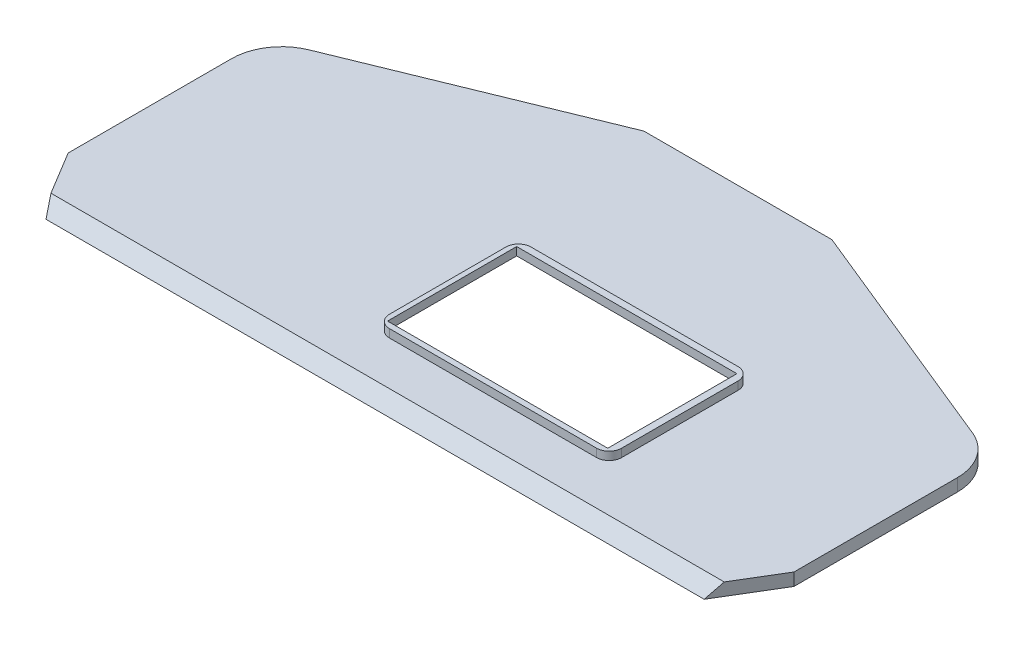
from build123d import *

# Parameters (mm, degrees)
SKETCH2_W           = 33
SKETCH2_H           = 17.000000000000007
BOSS_EXTRUDE1_DEPTH = 2
FILLET1_R           = 8
FILLET2_R           = 8
CHAMFER1_SIZE       = 2
CUT_EXTRUDE2_DEPTH  = 12
SKETCH6_W           = 1.2612446076729746
SKETCH6_H           = 17.000000000000007
BOSS_EXTRUDE3_DEPTH = 2
SKETCH8_W           = 37.024907352098374
SKETCH8_H           = 22.564000776868035
BOSS_EXTRUDE4_DEPTH = 1.3
FILLET4_R           = 2
FILLET5_R           = 2
FILLET6_R           = 2
FILLET7_R           = 2
CHAMFER2_SIZE       = 2
CHAMFER3_SIZE       = 2
CHAMFER4_SIZE       = 2
CHAMFER5_SIZE       = 2


with BuildPart() as part:
    # Sketch2 → Boss-Extrude1 (new body)
    with BuildSketch(Plane(origin=(0, 0, 0), x_dir=(1, 0, 0), z_dir=(0, 1, 0))):
        Polygon((-15.000000000000073, 76.00000000000003), (15.000000000000004, 76.00000000000003), (57.894125564998674, 58.48538895430336), (57.894125564998674, 27.05184462316343), (52.49999999999998, 18.118100444839456), (-52.50000000000002, 18.118100444839435), (-57.89412556499873, 27.051844623163408), (-57.894125564998745, 58.48538895430333), align=None)
        with Locations((11.999999999999982, 36.50000000000003)):
            Rectangle(SKETCH2_W, SKETCH2_H, mode=Mode.SUBTRACT)
    extrude(amount=BOSS_EXTRUDE1_DEPTH)

    # Fillet1
    fillet1_edges = [part.edges().sort_by_distance(p)[0] for p in [
        (57.894125564998674, 1, -58.48538895430336),
    ]]
    fillet(fillet1_edges, radius=FILLET1_R)

    # Fillet2
    fillet2_edges = [part.edges().sort_by_distance(p)[0] for p in [
        (-57.894125564998745, 1, -58.48538895430333),
    ]]
    fillet(fillet2_edges, radius=FILLET2_R)

    # Chamfer1
    chamfer1_edges = [part.edges().sort_by_distance(p)[0] for p in [
        (-2.132e-14, 2, -18.118100444839445),
    ]]
    chamfer(chamfer1_edges, length=CHAMFER1_SIZE - 0.0001)  # a hair under: the kernel refuses the full size

    # Sketch3 → Cut-Extrude2 (cut)
    with BuildSketch(Plane(origin=(0, 2, 0), x_dir=(1, 0, 0), z_dir=(0, 1, 0))):
        Polygon((-7.894125564998744, 48.60000000000001), (-7.894125564998744, 28.000000000000025), (-4.500000000000018, 28.000000000000025), (-4.500000000000018, 45.00000000000003), (-4.500000000000016, 48.60000000000002), align=None)
        Polygon((-4.500000000000018, 45.00000000000003), (27.238755392327008, 45.00000000000003), (27.238755392327008, 48.600000000000016), (-4.500000000000016, 48.60000000000002), align=None)
    extrude(amount=-CUT_EXTRUDE2_DEPTH, mode=Mode.SUBTRACT)

    # Sketch6 → Boss-Extrude3 (add)
    with BuildSketch(Plane(origin=(0, 2, 0), x_dir=(1, 0, 0), z_dir=(0, 1, 0))):
        with Locations((27.869377696163497, 36.50000000000003)):
            Rectangle(SKETCH6_W, SKETCH6_H)
    extrude(amount=-BOSS_EXTRUDE3_DEPTH)

    # Sketch8 → Boss-Extrude4 (add)
    with BuildSketch(Plane(origin=(0, 2, 0), x_dir=(1, 0, 0), z_dir=(0, 1, 0))):
        with Locations((9.826111603405227, 38.39621794248441)):
            Rectangle(SKETCH8_W, SKETCH8_H)
        Polygon((-7.894125564998744, 48.60000000000001), (27.238755392327008, 48.600000000000016), (27.238755392327008, 28.000000000000025), (-7.894125564998744, 28.000000000000025), align=None, mode=Mode.SUBTRACT)
    extrude(amount=BOSS_EXTRUDE4_DEPTH)

    # Fillet4
    fillet4_edges = [part.edges().sort_by_distance(p)[0] for p in [
        (-8.68634207264396, 2.65, -49.67821833091842),
    ]]
    fillet(fillet4_edges, radius=FILLET4_R)

    # Fillet5
    fillet5_edges = [part.edges().sort_by_distance(p)[0] for p in [
        (28.338565279454414, 2.65, -49.67821833091842),
    ]]
    fillet(fillet5_edges, radius=FILLET5_R)

    # Fillet6
    fillet6_edges = [part.edges().sort_by_distance(p)[0] for p in [
        (28.338565279454414, 2.65, -27.11421755405039),
    ]]
    fillet(fillet6_edges, radius=FILLET6_R)

    # Fillet7
    fillet7_edges = [part.edges().sort_by_distance(p)[0] for p in [
        (-8.68634207264396, 2.65, -27.11421755405039),
    ]]
    fillet(fillet7_edges, radius=FILLET7_R)

    # Chamfer2
    chamfer2_edges = [part.edges().sort_by_distance(p)[0] for p in [
        (27.238755392327008, 0, -38.30000000000002),
    ]]
    chamfer(chamfer2_edges, length=CHAMFER2_SIZE)

    # Chamfer3
    chamfer3_edges = [part.edges().sort_by_distance(p)[0] for p in [
        (10.672314913664133, 0, -28.000000000000025),
    ]]
    chamfer(chamfer3_edges, length=CHAMFER3_SIZE)

    # Chamfer4
    chamfer4_edges = [part.edges().sort_by_distance(p)[0] for p in [
        (-7.894125564998744, 0, -37.30000000000002),
    ]]
    chamfer(chamfer4_edges, length=CHAMFER4_SIZE)

    # Chamfer5
    chamfer5_edges = [part.edges().sort_by_distance(p)[0] for p in [
        (9.672314913664131, 0, -48.60000000000009),
    ]]
    chamfer(chamfer5_edges, length=CHAMFER5_SIZE)


solid = part.part
